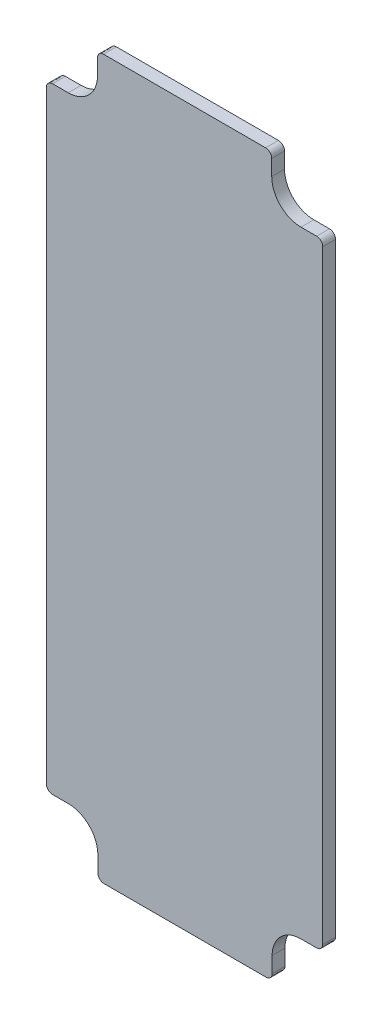
from build123d import *

# Parameters (mm, degrees)
BOSS_EXTRUDE1_DEPTH = 1.57


with BuildPart() as part:
    # Sketch2 → Boss-Extrude1 (new body)
    with BuildSketch(Plane.XY.offset(5)):
        with BuildLine():
            Line((-16.920508995, -36.92485167), (-16.920508995, 36.97485167))
            add(Edge.make_bspline(
                [(-16.920508995, 36.97485167), (-16.920508995, 37.068017422), (-16.888464247, 37.250238191), (-16.71855323, 37.51855323), (-16.450238191, 37.688464247), (-16.268017422, 37.720508995), (-16.17485167, 37.720508995)],
                knots=[0, 0, 0, 0, 0.25, 0.5, 0.75, 1, 1, 1, 1], degree=3))
            Line((-16.17485167, 37.720508995), (-14.25, 37.720508995))
            ThreePointArc((-14.25, 37.720508995), (-11.718917637, 38.768917637), (-10.670508995, 41.3))
            Line((-10.670508995, 41.3), (-10.670508995, 43.22485167))
            add(Edge.make_bspline(
                [(-10.670508995, 43.22485167), (-10.670508995, 43.318017422), (-10.638464247, 43.500238191), (-10.46855323, 43.76855323), (-10.200238191, 43.938464247), (-10.018017422, 43.970508995), (-9.92485167, 43.970508995)],
                knots=[0, 0, 0, 0, 0.25, 0.5, 0.75, 1, 1, 1, 1], degree=3))
            Line((-9.92485167, 43.970508995), (9.92485167, 43.970508995))
            add(Edge.make_bspline(
                [(9.92485167, 43.970508995), (10.018017422, 43.970508995), (10.200238191, 43.938464247), (10.46855323, 43.76855323), (10.638464247, 43.500238191), (10.670508995, 43.318017422), (10.670508995, 43.22485167)],
                knots=[0, 0, 0, 0, 0.25, 0.5, 0.75, 1, 1, 1, 1], degree=3))
            Line((10.670508995, 43.22485167), (10.670508995, 41.3))
            ThreePointArc((10.670508995, 41.3), (11.718917637, 38.768917637), (14.25, 37.720508995))
            Line((14.25, 37.720508995), (16.17485167, 37.720508995))
            add(Edge.make_bspline(
                [(16.17485167, 37.720508995), (16.268017422, 37.720508995), (16.450238191, 37.688464247), (16.71855323, 37.51855323), (16.888464247, 37.250238191), (16.920508995, 37.068017422), (16.920508995, 36.97485167)],
                knots=[0, 0, 0, 0, 0.25, 0.5, 0.75, 1, 1, 1, 1], degree=3))
            Line((16.920508995, 36.97485167), (16.920508995, -37.02485167))
            add(Edge.make_bspline(
                [(16.920508995, -37.02485167), (16.920508995, -37.118017422), (16.888464247, -37.300238191), (16.71855323, -37.56855323), (16.450238191, -37.738464247), (16.268017422, -37.770508995), (16.17485167, -37.770508995)],
                knots=[0, 0, 0, 0, 0.25, 0.5, 0.75, 1, 1, 1, 1], degree=3))
            Line((16.17485167, -37.770508995), (14.25, -37.770508995))
            ThreePointArc((14.25, -37.770508995), (11.754272976, -38.804272976), (10.720508995, -41.3))
            Line((10.720508995, -41.3), (10.720508995, -43.22485167))
            add(Edge.make_bspline(
                [(10.720508995, -43.22485167), (10.720508995, -43.318017422), (10.688464247, -43.500238191), (10.51855323, -43.76855323), (10.250238191, -43.938464247), (10.068017422, -43.970508995), (9.97485167, -43.970508995)],
                knots=[0, 0, 0, 0, 0.25, 0.5, 0.75, 1, 1, 1, 1], degree=3))
            Line((9.97485167, -43.970508995), (-9.87485167, -43.970508995))
            add(Edge.make_bspline(
                [(-9.87485167, -43.970508995), (-9.968017422, -43.970508995), (-10.150238191, -43.938464247), (-10.41855323, -43.76855323), (-10.588464247, -43.500238191), (-10.620508995, -43.318017422), (-10.620508995, -43.22485167)],
                knots=[0, 0, 0, 0, 0.25, 0.5, 0.75, 1, 1, 1, 1], degree=3))
            Line((-10.620508995, -43.22485167), (-10.620508995, -41.3))
            ThreePointArc((-10.620508995, -41.3), (-11.683562298, -38.733562298), (-14.25, -37.670508995))
            Line((-14.25, -37.670508995), (-16.17485167, -37.670508995))
            add(Edge.make_bspline(
                [(-16.17485167, -37.670508995), (-16.268017422, -37.670508995), (-16.450238191, -37.638464247), (-16.71855323, -37.46855323), (-16.888464247, -37.200238191), (-16.920508995, -37.018017422), (-16.920508995, -36.92485167)],
                knots=[0, 0, 0, 0, 0.25, 0.5, 0.75, 1, 1, 1, 1], degree=3))
        make_face()
    extrude(amount=BOSS_EXTRUDE1_DEPTH)


solid = part.part
